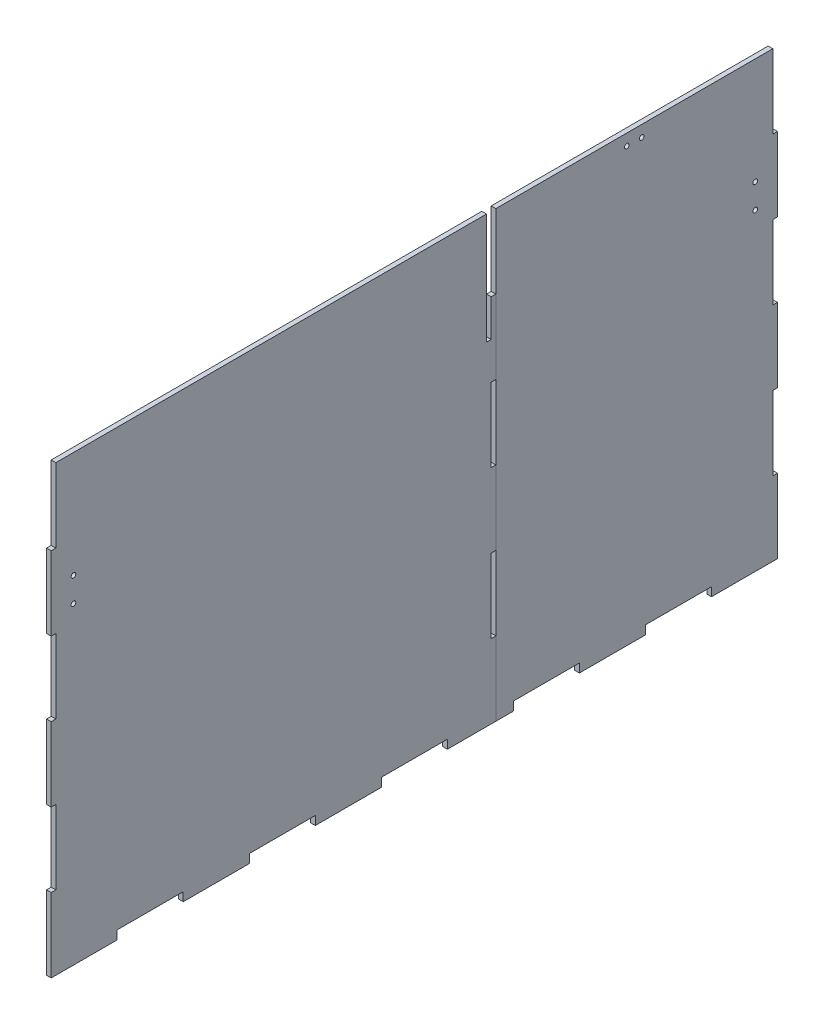
from build123d import *

# Parameters (mm, degrees)
BOSS_EXTRUDE1_DEPTH     = 1.4986
BOSS_EXTRUDE2_DEPTH     = 1.4986
SKETCH4_W               = 2.9972
SKETCH4_H               = 47.498
CUT_EXTRUDE1_DEPTH      = 275.683887641
SKETCH9_R               = 1.5
CUT_EXTRUDE4_DEPTH      = 275.683887641
CUT_EXTRUDE5_DEPTH      = 275.671623441
CUT_EXTRUDE5_DEPTH_BACK = 275.671623441
SKETCH10_R              = 1.5
SPLIT1_SURFACE_1_BACK   = 547.408
SPLIT1_SURFACE_1_DEPTH  = 1094.816
SPLIT1_SURFACE_2_BACK   = 547.408
SPLIT1_SURFACE_2_DEPTH  = 1094.816


with BuildPart() as part:
    # Sketch1 → Boss-Extrude1 (new, symmetric)
    with BuildSketch(Plane(origin=(0, 0, 0), x_dir=(0, 0, -1), z_dir=(1, 0, 0))):
        Polygon((-230.0986, 139.7), (-230.0986, 92.202), (-233.0958, 92.202), (-233.0958, 44.704), (-230.0986, 44.704), (-230.0986, -2.794), (-233.0958, -2.794), (-233.0958, -50.292), (-230.0986, -50.292), (-230.0986, -97.79), (-233.0958, -97.79), (-233.0958, -145.288), (-190.714745455, -145.288), (-190.714745455, -139.7), (-148.333690909, -139.7), (-148.333690909, -145.288), (-105.952636364, -145.288), (-105.952636364, -139.7), (-63.571581818, -139.7), (-63.571581818, -145.288), (-21.190527273, -145.288), (-21.190527273, -139.7), (21.190527273, -139.7), (21.190527273, -145.288), (52.2986, -145.288), (52.2986, 139.7), align=None)
    extrude(amount=BOSS_EXTRUDE1_DEPTH, both=True)

    # Sketch1<3> → Boss-Extrude2 (add, symmetric)
    with BuildSketch(Plane(origin=(0, 0, 0), x_dir=(0, 0, -1), z_dir=(1, 0, 0))):
        Polygon((230.0986, 139.7), (52.2986, 139.7), (52.2986, -145.288), (63.571581818, -145.288), (63.571581818, -139.7), (105.952636364, -139.7), (105.952636364, -145.288), (148.333690909, -145.288), (148.333690909, -139.7), (190.714745455, -139.7), (190.714745455, -145.288), (233.0958, -145.288), (233.0958, -97.79), (230.0986, -97.79), (230.0986, -50.292), (233.0958, -50.292), (233.0958, -2.794), (230.0986, -2.794), (230.0986, 44.704), (233.0958, 44.704), (233.0958, 92.202), (230.0986, 92.202), align=None)
    extrude(amount=BOSS_EXTRUDE2_DEPTH, both=True)

    # Sketch4 → Cut-Extrude1 (cut, through all)
    with BuildSketch(Plane(origin=(1.4986, 0, 0), x_dir=(0, 0, -1), z_dir=(1, 0, 0))):
        Polygon((52.2986, 139.7), (46.3042, 139.7), (46.3042, 68.453), (49.3014, 68.453), (49.3014, 92.202), (52.2986, 92.202), align=None)
        with Locations((50.8, 20.955)):
            Rectangle(SKETCH4_W, SKETCH4_H)
        with Locations((50.8, -74.041)):
            Rectangle(SKETCH4_W, SKETCH4_H)
    extrude(amount=-CUT_EXTRUDE1_DEPTH, mode=Mode.SUBTRACT)

    # Sketch9 → Cut-Extrude4 (cut, through all)
    with BuildSketch(Plane(origin=(1.4986, 0, 0), x_dir=(0, 0, -1), z_dir=(1, 0, 0))):
        with Locations((-218.8083, 71.374)):
            Circle(SKETCH9_R)
        with Locations((-218.8083, 55.626)):
            Circle(SKETCH9_R)
        with Locations((218.8083, 71.374)):
            Circle(SKETCH9_R)
        with Locations((218.8083, 55.626)):
            Circle(SKETCH9_R)
    extrude(amount=-CUT_EXTRUDE4_DEPTH, mode=Mode.SUBTRACT)

    # Sketch10 → Cut-Extrude5 (cut, two sides: drawn at the far end of the back side and taken through both)
    with BuildSketch(Plane(origin=(0, 0, 0), x_dir=(0, 0, -1), z_dir=(1, 0, 0)).offset(-CUT_EXTRUDE5_DEPTH_BACK)):
        with Locations((145.9611, 132.3975)):
            Circle(SKETCH10_R)
        with Locations((136.4361, 132.3975)):
            Circle(SKETCH10_R)
    extrude(amount=CUT_EXTRUDE5_DEPTH + CUT_EXTRUDE5_DEPTH_BACK, mode=Mode.SUBTRACT)


with BuildPart() as body_2:
    # Split1: the piece behind the surface
    add(part.part)
    # Split1 surface: a surface, the sketch's curves swept straight by 1094.816 mm
    with BuildLine(Plane(origin=(1.4986, 0, 0), x_dir=(0, 0, -1), z_dir=(1, 0, 0)).offset(-SPLIT1_SURFACE_1_BACK), mode=Mode.PRIVATE) as split1_surface_1_path:
        Line((52.2986, 139.7), (52.2986, -145.288))
    split1_surface_1 = Shell.extrude(split1_surface_1_path.wire(), (1 * SPLIT1_SURFACE_1_DEPTH, 0 * SPLIT1_SURFACE_1_DEPTH, 0 * SPLIT1_SURFACE_1_DEPTH))
    split(bisect_by=split1_surface_1, keep=Keep.BOTTOM)


with BuildPart() as part_1:
    add(part.part)

    # Split1: split by a surface, the side it looks to stays
    # Split1 surface: a surface, the sketch's curves swept straight by 1094.816 mm
    with BuildLine(Plane(origin=(1.4986, 0, 0), x_dir=(0, 0, -1), z_dir=(1, 0, 0)).offset(-SPLIT1_SURFACE_2_BACK), mode=Mode.PRIVATE) as split1_surface_2_path:
        Line((52.2986, 139.7), (52.2986, -145.288))
    split1_surface_2 = Shell.extrude(split1_surface_2_path.wire(), (1 * SPLIT1_SURFACE_2_DEPTH, 0 * SPLIT1_SURFACE_2_DEPTH, 0 * SPLIT1_SURFACE_2_DEPTH))
    split(bisect_by=split1_surface_2, keep=Keep.TOP)


solid = Compound([body_2.part, part_1.part])
